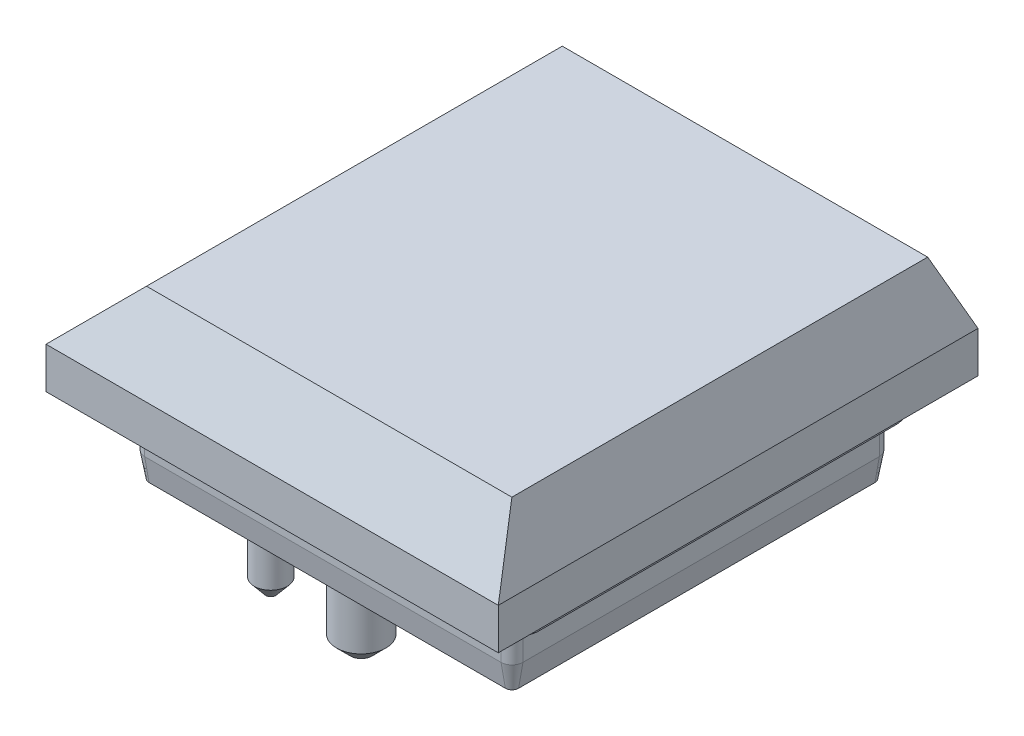
from build123d import *
from OCP.BRepFilletAPI import BRepFilletAPI_MakeChamfer

# Parameters (mm, degrees)
BOSS_EXTRUDE1_DEPTH = 0.8
BOSS_EXTRUDE2_DEPTH = 1.3
BOSS_EXTRUDE3_DEPTH = 0.9
BOSS_EXTRUDE3_TAPER = 10
SKETCH4_R           = 1.6
SKETCH4_R_2         = 0.9
BOSS_EXTRUDE4_DEPTH = 2.65
SKETCH5_R           = 0.6
BOSS_EXTRUDE5_DEPTH = 3
CHAMFER1_SIZE       = 0.5
CHAMFER1_SIZE2      = 0.419549816
CHAMFER2_SIZE       = 0.5
SKETCH6_W           = 16.5
SKETCH6_H           = 17.5
BOSS_EXTRUDE6_DEPTH = 4
CHAMFER3_SIZE       = 2.5
CHAMFER3_SIZE2      = 0.669872981
CHAMFER4_SIZE       = 2.5
CHAMFER4_SIZE2      = 1.165769145
CHAMFER5_SIZE       = 2.5


with BuildPart() as part:
    # Sketch1 → Boss-Extrude1 (new body)
    with BuildSketch(Plane(origin=(0, 0, 0), x_dir=(1, 0, 0), z_dir=(0, 1, 0))):
        with BuildLine():
            Line((-6.5, -7.5), (6.5, -7.5))
            ThreePointArc((6.5, -7.5), (7.207106781, -7.207106781), (7.5, -6.5))
            Line((7.5, -6.5), (7.5, 6.5))
            ThreePointArc((7.5, 6.5), (7.207106781, 7.207106781), (6.5, 7.5))
            Line((6.5, 7.5), (-6.5, 7.5))
            ThreePointArc((-6.5, 7.5), (-7.207106781, 7.207106781), (-7.5, 6.5))
            Line((-7.5, 6.5), (-7.5, -6.5))
            ThreePointArc((-7.5, -6.5), (-7.207106781, -7.207106781), (-6.5, -7.5))
        make_face()
    extrude(amount=BOSS_EXTRUDE1_DEPTH)

    # Sketch2 → Boss-Extrude2 (add)
    with BuildSketch(Plane.XZ):
        with BuildLine():
            Line((-6.9, 6.5), (-6.9, -6.5))
            ThreePointArc((-6.9, -6.5), (-6.782842712, -6.782842712), (-6.5, -6.9))
            Line((-6.5, -6.9), (6.5, -6.9))
            ThreePointArc((6.5, -6.9), (6.782842712, -6.782842712), (6.9, -6.5))
            Line((6.9, -6.5), (6.9, 6.5))
            ThreePointArc((6.9, 6.5), (6.782842712, 6.782842712), (6.5, 6.9))
            Line((6.5, 6.9), (-6.5, 6.9))
            ThreePointArc((-6.5, 6.9), (-6.782842712, 6.782842712), (-6.9, 6.5))
        make_face()
    extrude(amount=BOSS_EXTRUDE2_DEPTH)

    # Sketch3 → Boss-Extrude3 (add)
    with BuildSketch(Plane.XZ.offset(1.3)):
        with BuildLine():
            Line((-6.9, 6.5), (-6.9, -6.5))
            ThreePointArc((-6.9, -6.5), (-6.782842712, -6.782842712), (-6.5, -6.9))
            Line((-6.5, -6.9), (6.5, -6.9))
            ThreePointArc((6.5, -6.9), (6.782842712, -6.782842712), (6.9, -6.5))
            Line((6.9, -6.5), (6.9, 6.5))
            ThreePointArc((6.9, 6.5), (6.782842712, 6.782842712), (6.5, 6.9))
            Line((6.5, 6.9), (-6.5, 6.9))
            ThreePointArc((-6.5, 6.9), (-6.782842712, 6.782842712), (-6.9, 6.5))
        make_face()
    extrude(amount=BOSS_EXTRUDE3_DEPTH, taper=BOSS_EXTRUDE3_TAPER)

    # Sketch4 → Boss-Extrude4 (add)
    with BuildSketch(Plane.XZ.offset(2.2)):
        Circle(SKETCH4_R)
        with Locations((0, -5.5)):
            Circle(SKETCH4_R_2)
        with Locations((0, 5.5)):
            Circle(SKETCH4_R_2)
    extrude(amount=BOSS_EXTRUDE4_DEPTH)

    # Sketch5 → Boss-Extrude5 (add)
    with BuildSketch(Plane.XZ.offset(2.2)):
        with Locations((-5.9, 0)):
            Circle(SKETCH5_R)
        with Locations((-3.8, -5)):
            Circle(SKETCH5_R)
        with Locations((-3.8, 5)):
            Circle(SKETCH5_R)
    extrude(amount=BOSS_EXTRUDE5_DEPTH)

    # Chamfer1: one chamfer whose edges measure the first distance from different faces: ONE call of the kernel's chamfer builder (chamfer() names one face for all edges)
    chamfer1_edges_1 = [part.edges().sort_by_distance(p)[0] for p in [
        (-4.4, -5.2, -5),
    ]]
    chamfer1_side_1 = [part.faces().sort_by_distance(p)[0] for p in [
        (-4.4, -3.7, -5),
    ]]
    chamfer1_edges_2 = [part.edges().sort_by_distance(p)[0] for p in [
        (-6.5, -5.2, 0),
    ]]
    chamfer1_side_2 = [part.faces().sort_by_distance(p)[0] for p in [
        (-6.5, -3.7, 0),
    ]]
    chamfer1_edges_3 = [part.edges().sort_by_distance(p)[0] for p in [
        (-4.4, -5.2, 5),
    ]]
    chamfer1_side_3 = [part.faces().sort_by_distance(p)[0] for p in [
        (-4.4, -3.7, 5),
    ]]
    chamfer1 = BRepFilletAPI_MakeChamfer(part.part.solid().wrapped)
    for e in chamfer1_edges_1:
        chamfer1.Add(CHAMFER1_SIZE, CHAMFER1_SIZE2, e.wrapped, chamfer1_side_1[0].wrapped)  # the first distance lies on this face
    for e in chamfer1_edges_2:
        chamfer1.Add(CHAMFER1_SIZE, CHAMFER1_SIZE2, e.wrapped, chamfer1_side_2[0].wrapped)  # the first distance lies on this face
    for e in chamfer1_edges_3:
        chamfer1.Add(CHAMFER1_SIZE, CHAMFER1_SIZE2, e.wrapped, chamfer1_side_3[0].wrapped)  # the first distance lies on this face
    add(Compound.cast(chamfer1.Shape()), mode=Mode.REPLACE)

    # Chamfer2
    chamfer2_edges = [part.edges().sort_by_distance(p)[0] for p in [
        (-0.9, -4.85, -5.5),
        (-1.6, -4.85, 0),
        (-0.9, -4.85, 5.5),
    ]]
    chamfer(chamfer2_edges, length=CHAMFER2_SIZE)

    # Sketch6 → Boss-Extrude6 (add)
    with BuildSketch(Plane(origin=(0, 0.8, 0), x_dir=(1, 0, 0), z_dir=(0, 1, 0))):
        Rectangle(SKETCH6_W, SKETCH6_H)
    extrude(amount=BOSS_EXTRUDE6_DEPTH)

    # Chamfer3
    chamfer3_edges = [part.edges().sort_by_distance(p)[0] for p in [
        (8.25, 4.8, 0),
    ]]
    chamfer3_side = [part.faces().sort_by_distance(p)[0] for p in [
        (8.25, 2.8, 0),
    ]]
    chamfer(chamfer3_edges, length=CHAMFER3_SIZE, length2=CHAMFER3_SIZE2, reference=chamfer3_side[0])

    # Chamfer4: one chamfer whose edges measure the first distance from different faces: ONE call of the kernel's chamfer builder (chamfer() names one face for all edges)
    chamfer4_edges_1 = [part.edges().sort_by_distance(p)[0] for p in [
        (-0.334936491, 4.8, -8.75),
    ]]
    chamfer4_side_1 = [part.faces().sort_by_distance(p)[0] for p in [
        (-0.103143341, 2.785008314, -8.75),
    ]]
    chamfer4_edges_2 = [part.edges().sort_by_distance(p)[0] for p in [
        (-0.334936491, 4.8, 8.75),
    ]]
    chamfer4_side_2 = [part.faces().sort_by_distance(p)[0] for p in [
        (-0.103143341, 2.785008314, 8.75),
    ]]
    chamfer4 = BRepFilletAPI_MakeChamfer(part.part.solid().wrapped)
    for e in chamfer4_edges_1:
        chamfer4.Add(CHAMFER4_SIZE, CHAMFER4_SIZE2, e.wrapped, chamfer4_side_1[0].wrapped)  # the first distance lies on this face
    for e in chamfer4_edges_2:
        chamfer4.Add(CHAMFER4_SIZE, CHAMFER4_SIZE2, e.wrapped, chamfer4_side_2[0].wrapped)  # the first distance lies on this face
    add(Compound.cast(chamfer4.Shape()), mode=Mode.REPLACE)

    # Chamfer5
    chamfer5_edges = [part.edges().sort_by_distance(p)[0] for p in [
        (-8.25, 4.8, 0),
    ]]
    chamfer(chamfer5_edges, length=CHAMFER5_SIZE)


solid = part.part
